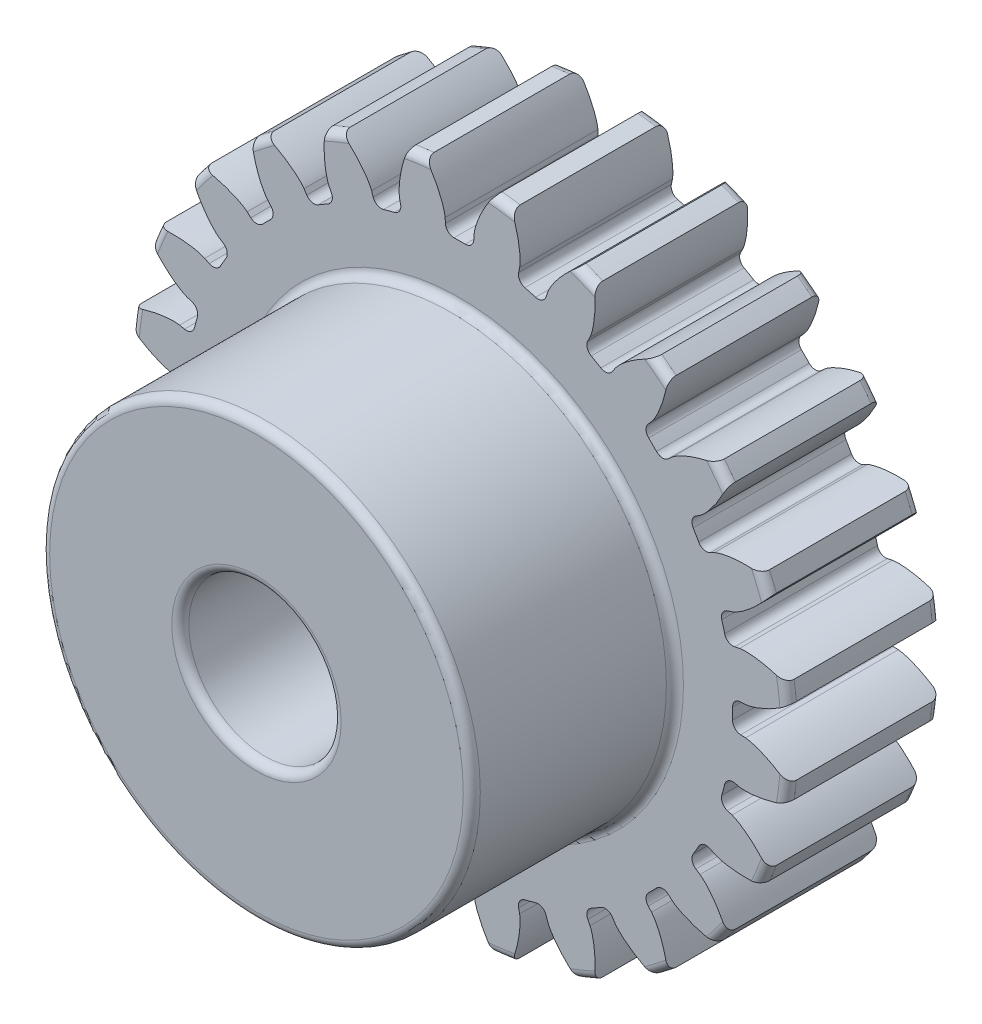
from build123d import *

# Parameters (mm, degrees)
BOSS_EXTRUDE1_DEPTH      = 5.5626
BOSS_EXTRUDE1_DEPTH_BACK = 5.5626
SKETCH3_R                = 10.31875
SKETCH5_W                = 6.35
SKETCH5_H                = 3.58775
SKETCH5_W_2              = 11.1252
SKETCH5_H_2              = 2.38125
FILLET2_R                = 0.266307122
CUT_EXTRUDE1_DEPTH       = 16.617161236
FILLET1_R                = 0.266307122
CIRPATTERN1_COUNT        = 24
FILLET1_OF_CIRPATTERN1_R = 0.266307122


with BuildPart() as part:
    # Sketch3 → Boss-Extrude1 (new, two sides: drawn at the far end of the back side and taken through both)
    with BuildSketch(Plane.XY.offset(-BOSS_EXTRUDE1_DEPTH_BACK)):
        Circle(SKETCH3_R)
    extrude(amount=BOSS_EXTRUDE1_DEPTH + BOSS_EXTRUDE1_DEPTH_BACK)

    # Sketch5 → Cut-Revolve1 (revolve, cut)
    with BuildSketch(Plane(origin=(0, 0, 0), x_dir=(0, 0, -1), z_dir=(1, 0, 0)), mode=Mode.PRIVATE) as cut_revolve1_sk:
        with Locations((-2.3876, 8.524875)):
            Rectangle(SKETCH5_W, SKETCH5_H)
        with Locations((0, 1.190625)):
            Rectangle(SKETCH5_W_2, SKETCH5_H_2)
    revolve(cut_revolve1_sk.sketch.rotate(Axis((0, 0, 5.5626), (0, 0, -1)), 90), axis=Axis((0, 0, 5.5626), (0, 0, -1)), mode=Mode.SUBTRACT)

    # Fillet2
    fillet2_edges = [part.edges().sort_by_distance(p)[0] for p in [
        (-2.38125, 0, 5.5626),
        (-2.38125, 0, -5.5626),
        (-6.731, 0, 5.5626),
        (-6.731, 0, -0.7874),
        (-10.31875, 0, -0.7874),
        (-10.31875, 0, -5.5626),
    ]]
    fillet(fillet2_edges, radius=FILLET2_R)

    # Sketch4 → Cut-Extrude1 (cut, symmetric)
    with BuildSketch(Plane.XY):
        with BuildLine():
            Line((8.521914819, 0.431111334), (8.93914099, 0.452218202))
            add(Edge.make_bspline(
                [(8.93914099, 0.452218202), (8.941314487, 0.452354618), (8.947405736, 0.452818946), (8.958901283, 0.454019424), (8.977624195, 0.456436153), (9.001423763, 0.460188025), (9.032110837, 0.465808813), (9.068155889, 0.473421329), (9.107647073, 0.482824216), (9.150468638, 0.494171482), (9.193053168, 0.506478612), (9.235397469, 0.519672309), (9.277450483, 0.533641137), (9.328228355, 0.551535837), (9.38888453, 0.574346019), (9.459419453, 0.602972635), (9.538968781, 0.637754129), (9.619529736, 0.675667906), (9.698368288, 0.714998089), (9.77749258, 0.757051473), (9.853670669, 0.799380364), (9.932213019, 0.845705377), (10.004417293, 0.889666218), (10.084630089, 0.941514061), (10.149166226, 0.984114854), (10.215239019, 1.030275997), (10.247308502, 1.053060348), (10.263660234, 1.064838095)],
                knots=[0, 0, 0, 0, 0, 0.005376749, 0.015083688, 0.02853182, 0.04661014, 0.064854849, 0.092110526, 0.119476176, 0.146842496, 0.174208854, 0.201574956, 0.228941013, 0.256307345, 0.307035032, 0.361767352, 0.416499661, 0.471231937, 0.525964282, 0.580696616, 0.635428982, 0.690161387, 0.744893688, 0.799626082, 0.854358407, 0.909090914, 0.909090914, 0.909090914, 0.909090914, 0.909090914], degree=4))
            ThreePointArc((10.263660234, 1.064838095), (10.31875, 0), (10.263660234, -1.064838095))
            add(Edge.make_bspline(
                [(8.93914099, -0.452218202), (8.941314487, -0.452354618), (8.947405736, -0.452818946), (8.958901283, -0.454019424), (8.977624195, -0.456436153), (9.001423763, -0.460188025), (9.032110837, -0.465808813), (9.068155889, -0.473421329), (9.107647073, -0.482824216), (9.150468638, -0.494171482), (9.193053168, -0.506478612), (9.235397469, -0.519672309), (9.277450483, -0.533641137), (9.328228355, -0.551535837), (9.38888453, -0.574346019), (9.459419453, -0.602972635), (9.538968781, -0.637754129), (9.619529736, -0.675667906), (9.698368288, -0.714998089), (9.77749258, -0.757051473), (9.853670669, -0.799380364), (9.932213019, -0.845705377), (10.004417293, -0.889666218), (10.084630089, -0.941514061), (10.149166226, -0.984114854), (10.215239019, -1.030275997), (10.247308502, -1.053060348), (10.263660234, -1.064838095)],
                knots=[0, 0, 0, 0, 0, 0.005376749, 0.015083688, 0.02853182, 0.04661014, 0.064854849, 0.092110526, 0.119476176, 0.146842496, 0.174208854, 0.201574956, 0.228941013, 0.256307345, 0.307035032, 0.361767352, 0.416499661, 0.471231937, 0.525964282, 0.580696616, 0.635428982, 0.690161387, 0.744893688, 0.799626082, 0.854358407, 0.909090914, 0.909090914, 0.909090914, 0.909090914, 0.909090914], degree=4))
            Line((8.93914099, -0.452218202), (8.521914819, -0.431111334))
            ThreePointArc((8.521914819, -0.431111334), (8.5328125, 0), (8.521914819, 0.431111334))
        make_face()
    cut_extrude1 = extrude(amount=CUT_EXTRUDE1_DEPTH, both=True, mode=Mode.SUBTRACT)

    # Fillet1
    fillet1_edges = [part.edges().sort_by_distance(p)[0] for p in [
        (8.521914819, -0.431111334, -3.175),
        (8.521914819, 0.431111334, -3.175),
    ]]
    fillet(fillet1_edges, radius=FILLET1_R)

    # CirPattern1: Cut-Extrude1 ×24 about axis
    cirpattern1_axis = Axis((0, 0, 5.5626), (0, 0, -1))
    for i in range(1, CIRPATTERN1_COUNT):
        add(cut_extrude1.rotate(cirpattern1_axis, i * 360 / CIRPATTERN1_COUNT), mode=Mode.SUBTRACT)

    # Fillet1 of CirPattern1
    fillet1_of_cirpattern1_edges = [part.edges().sort_by_distance(p)[0] for p in [
        (8.119957789, -2.622055427, -3.175),
        (8.343117437, -1.789212284, -3.175),
        (7.164639055, -4.634310777, -3.175),
        (7.595750389, -3.887604042, -3.175),
        (5.721062009, -6.330745505, -3.175),
        (6.330745505, -5.721062009, -3.175),
        (3.887604042, -7.595750389, -3.175),
        (4.634310777, -7.164639055, -3.175),
        (1.789212284, -8.343117437, -3.175),
        (2.622055427, -8.119957789, -3.175),
        (-0.431111334, -8.521914819, -3.175),
        (0.431111334, -8.521914819, -3.175),
        (-2.622055427, -8.119957789, -3.175),
        (-1.789212284, -8.343117437, -3.175),
        (-4.634310777, -7.164639055, -3.175),
        (-3.887604042, -7.595750389, -3.175),
        (-6.330745505, -5.721062009, -3.175),
        (-5.721062009, -6.330745505, -3.175),
        (-7.595750389, -3.887604042, -3.175),
        (-7.164639055, -4.634310777, -3.175),
        (-8.343117437, -1.789212284, -3.175),
        (-8.119957789, -2.622055427, -3.175),
        (-8.521914819, 0.431111334, -3.175),
        (-8.521914819, -0.431111334, -3.175),
        (-8.119957789, 2.622055427, -3.175),
        (-8.343117437, 1.789212284, -3.175),
        (-7.164639055, 4.634310777, -3.175),
        (-7.595750389, 3.887604042, -3.175),
        (-5.721062009, 6.330745505, -3.175),
        (-6.330745505, 5.721062009, -3.175),
        (-3.887604042, 7.595750389, -3.175),
        (-4.634310777, 7.164639055, -3.175),
        (-1.789212284, 8.343117437, -3.175),
        (-2.622055427, 8.119957789, -3.175),
        (0.431111334, 8.521914819, -3.175),
        (-0.431111334, 8.521914819, -3.175),
        (2.622055427, 8.119957789, -3.175),
        (1.789212284, 8.343117437, -3.175),
        (4.634310777, 7.164639055, -3.175),
        (3.887604042, 7.595750389, -3.175),
        (6.330745505, 5.721062009, -3.175),
        (5.721062009, 6.330745505, -3.175),
        (7.595750389, 3.887604042, -3.175),
        (7.164639055, 4.634310777, -3.175),
        (8.343117437, 1.789212284, -3.175),
        (8.119957789, 2.622055427, -3.175),
    ]]
    fillet(fillet1_of_cirpattern1_edges, radius=FILLET1_OF_CIRPATTERN1_R)


solid = part.part
